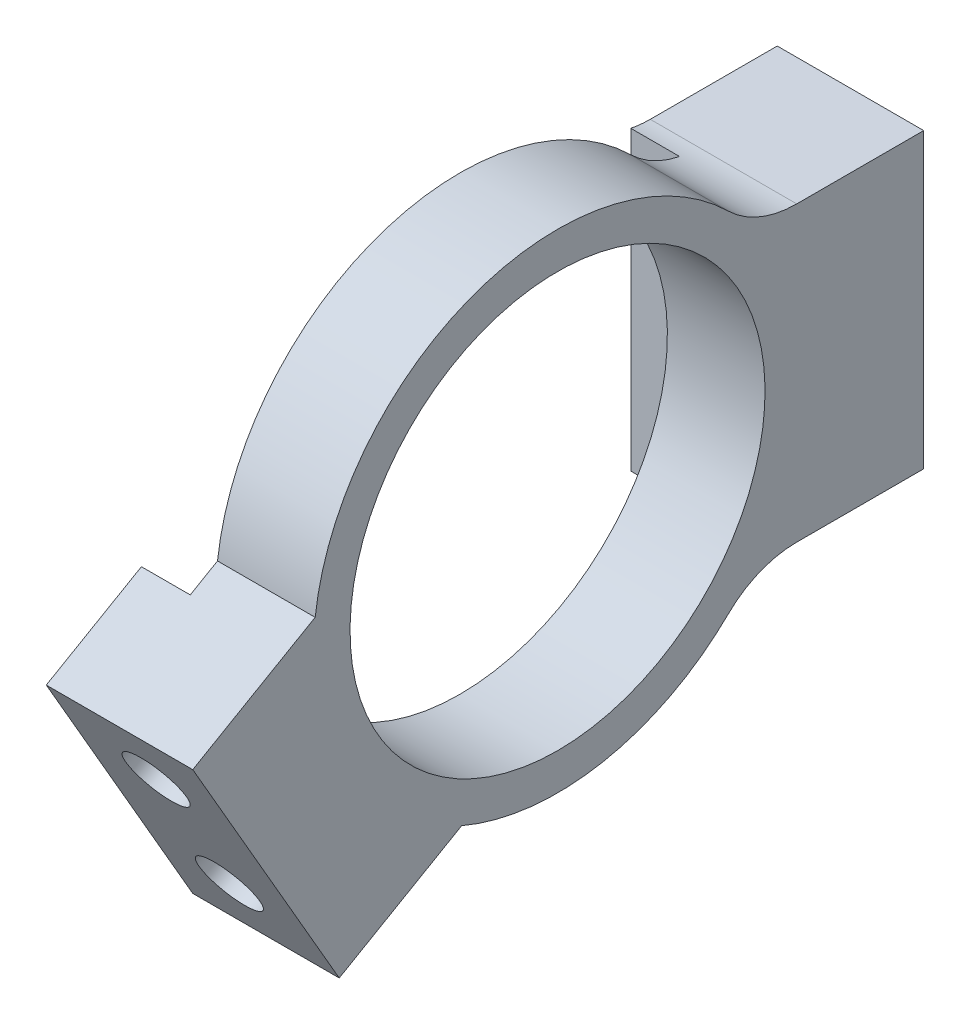
from build123d import *

# Parameters (mm, degrees)
SKETCH1_W       = 6
SKETCH1_H       = 12
EXTRUDE1_DEPTH  = 6
SKETCH3_W       = 4
SKETCH3_H       = 8.6
EXTRUDE2_DEPTH  = 1
SKETCH2_R       = 1.25
EXTRUDE3_DEPTH  = 5.5
EXTRUDE4_DEPTH  = 4
SKETCH6_R       = 8.5
EXTRUDE5_DEPTH  = 4
FILLET1_R       = 4
EXTRUDE9_START  = -4
EXTRUDE9_DEPTH  = 4
EXTRUDE10_DEPTH = 2
SKETCH14_R      = 1.25
EXTRUDE11_DEPTH = 4


with BuildPart() as part:
    # Sketch1 → Extrude1 (new body)
    with BuildSketch(Plane.XY):
        with Locations((-1, 0)):
            Rectangle(SKETCH1_W, SKETCH1_H)
    extrude(amount=EXTRUDE1_DEPTH)

    # Sketch3 → Extrude2 (add)
    with BuildSketch(Plane.XY.offset(6)):
        Rectangle(SKETCH3_W, SKETCH3_H)
    extrude(amount=EXTRUDE2_DEPTH)

    # Sketch2 → Extrude3 (cut)
    with BuildSketch(Plane(origin=(0, 0, 0), x_dir=(-1, 0, 0), z_dir=(0, 0, -1))):
        with Locations((1, 3)):
            Circle(SKETCH2_R)
        with Locations((1, -3)):
            Circle(SKETCH2_R)
    extrude(amount=-EXTRUDE3_DEPTH, mode=Mode.SUBTRACT)

    # Sketch4 → Extrude4 (add)
    with BuildSketch(Plane(origin=(2, 0, 0), x_dir=(0, 0, -1), z_dir=(1, 0, 0))):
        with BuildLine():
            Line((-7, 6), (-6, 6))
            Line((-6, 6), (-6, -6))
            Line((-6, -6), (-7, -6))
            ThreePointArc((-7, -6), (-25, 0), (-7, 6))
        make_face()
    extrude(amount=-EXTRUDE4_DEPTH)

    # Sketch6 → Extrude5 (cut)
    with BuildSketch(Plane.ZY.offset(2)):
        with Locations(Location((15, 0, 0), (0, 0, 270))):
            Circle(SKETCH6_R)
    extrude(amount=-EXTRUDE5_DEPTH, mode=Mode.SUBTRACT)

    # Fillet1
    # the kernel refuses this fillet: 4 mm, written as the material it adds along each edge
    with BuildSketch(Plane(origin=(2, 6, 7), x_dir=(0, 0, -1), z_dir=(-1, 0, 0))) as fillet1_piece_1_section:
        with BuildLine():
            CenterArc((1.797958971, -4), FILLET1_R, 90, 44.415308597)
            ThreePointArc((-1.001457878, -1.142857143), (-0.478989625, -0.590478203), (0, 0))
            Line((0, 0), (1.797958971, 0))
        make_face()
    fillet1_piece_1 = extrude(amount=4, mode=Mode.PRIVATE)
    fillet1_piece_1 = split(fillet1_piece_1, bisect_by=Plane(origin=(0, 5.976030652, 6), z_dir=(0, 0, -1)), keep=Keep.TOP, mode=Mode.PRIVATE)
    add(fillet1_piece_1)
    with BuildSketch(Plane(origin=(2, 6, 7), x_dir=(0, 0, -1), z_dir=(-1, 0, 0))) as fillet1_piece_2_section:
        with BuildLine():
            CenterArc((1.797958971, -4), FILLET1_R, 90, 44.415308597)
            ThreePointArc((-1.001457878, -1.142857143), (-0.478989625, -0.590478203), (0, 0))
            Line((0, 0), (1.797958971, 0))
        make_face()
    fillet1_piece_2 = extrude(amount=4, mode=Mode.PRIVATE)
    fillet1_piece_2 = split(fillet1_piece_2, bisect_by=Plane(origin=(0, 6.277319808, 6), z_dir=(0, 0, 1)), keep=Keep.TOP, mode=Mode.PRIVATE)
    add(fillet1_piece_2)
    with BuildSketch(Plane(origin=(2, 6, 7), x_dir=(0, 0, -1), z_dir=(-1, 0, 0))) as fillet1_piece_3_section:
        with BuildLine():
            CenterArc((1.797958971, -4), FILLET1_R, 90, 44.415308597)
            ThreePointArc((-1.001457878, -1.142857143), (-0.478989625, -0.590478203), (0, 0))
            Line((0, 0), (1.797958971, 0))
        make_face()
    fillet1_piece_3 = extrude(amount=8.494897428, mode=Mode.PRIVATE)
    fillet1_piece_3 = split(fillet1_piece_3, bisect_by=Plane(origin=(-4, 5.976030652, 5.651028554), z_dir=(1, 0, 0)), keep=Keep.TOP, mode=Mode.PRIVATE)
    fillet1_piece_3 = split(fillet1_piece_3, bisect_by=Plane(origin=(-3, 5.976030652, 6), z_dir=(0, 0, -1)), keep=Keep.TOP, mode=Mode.PRIVATE)
    fillet1_piece_3 = split(fillet1_piece_3, bisect_by=Plane(origin=(-2, 5.976030652, 5.651028554), z_dir=(-1, 0, 0)), keep=Keep.TOP, mode=Mode.PRIVATE)
    add(fillet1_piece_3)
    with BuildSketch(Plane(origin=(2, -6, 7), x_dir=(0, -0.7521010374968901, 0.6590478202650409), z_dir=(-1, 0, 0))) as fillet1_piece_4_section:
        with BuildLine():
            CenterArc((1.823463209, -3.988438089), FILLET1_R, 94.357396878, 44.415308597)
            Line((-1.184940941, -1.352246808), (0, 0))
            ThreePointArc((0, 0), (0.759776337, -0.028904778), (1.519552674, 0))
        make_face()
    fillet1_piece_4 = extrude(amount=4, mode=Mode.PRIVATE)
    fillet1_piece_4 = split(fillet1_piece_4, bisect_by=Plane(origin=(0, -6.277319808, 6), z_dir=(0, 0, 1)), keep=Keep.TOP, mode=Mode.PRIVATE)
    add(fillet1_piece_4)
    with BuildSketch(Plane(origin=(2, -6, 7), x_dir=(0, -0.7521010374968901, 0.6590478202650409), z_dir=(-1, 0, 0))) as fillet1_piece_5_section:
        with BuildLine():
            CenterArc((1.823463209, -3.988438089), FILLET1_R, 94.357396878, 44.415308597)
            Line((-1.184940941, -1.352246808), (0, 0))
            ThreePointArc((0, 0), (0.759776337, -0.028904778), (1.519552674, 0))
        make_face()
    fillet1_piece_5 = extrude(amount=4, mode=Mode.PRIVATE)
    fillet1_piece_5 = split(fillet1_piece_5, bisect_by=Plane(origin=(0, -5.976030652, 6), z_dir=(0, 0, -1)), keep=Keep.TOP, mode=Mode.PRIVATE)
    add(fillet1_piece_5)
    with BuildSketch(Plane(origin=(2, -6, 7), x_dir=(0, -0.7521010374968901, 0.6590478202650409), z_dir=(-1, 0, 0))) as fillet1_piece_6_section:
        with BuildLine():
            CenterArc((1.823463209, -3.988438089), FILLET1_R, 94.357396878, 44.415308597)
            Line((-1.184940941, -1.352246808), (0, 0))
            ThreePointArc((0, 0), (0.759776337, -0.028904778), (1.519552674, 0))
        make_face()
    fillet1_piece_6 = extrude(amount=8.494897428, mode=Mode.PRIVATE)
    fillet1_piece_6 = split(fillet1_piece_6, bisect_by=Plane(origin=(-4, -5.976030652, 5.651028554), z_dir=(1, 0, 0)), keep=Keep.TOP, mode=Mode.PRIVATE)
    fillet1_piece_6 = split(fillet1_piece_6, bisect_by=Plane(origin=(-3, -5.976030652, 6), z_dir=(0, 0, -1)), keep=Keep.TOP, mode=Mode.PRIVATE)
    fillet1_piece_6 = split(fillet1_piece_6, bisect_by=Plane(origin=(-2, -5.976030652, 5.651028554), z_dir=(-1, 0, 0)), keep=Keep.TOP, mode=Mode.PRIVATE)
    add(fillet1_piece_6)

    # Sketch12 → Extrude9 (add)
    with BuildSketch(Plane.ZY.offset(2).offset(EXTRUDE9_START)):
        with BuildLine():
            Line((18.92820323, -9.196152423), (23.942490318, -12.091152423))
            Line((23.942490318, -12.091152423), (29.942490318, -1.698847577))
            Line((29.942490318, -1.698847577), (24.92820323, 1.196152423))
            ThreePointArc((24.92820323, 1.196152423), (23.660254038, -5), (18.92820323, -9.196152423))
        make_face()
    extrude(amount=EXTRUDE9_DEPTH)

    # Sketch13 → Extrude10 (add)
    with BuildSketch(Plane.ZY.offset(2)):
        Polygon((29.942490318, -1.698847577), (26.045376001, 0.551152423), (20.045376001, -9.841152423), (23.942490318, -12.091152423), align=None)
    extrude(amount=EXTRUDE10_DEPTH)

    # Sketch14 → Extrude11 (cut)
    with BuildSketch(Plane(origin=(0, -13.390190528, 23.192490318), x_dir=(1, 0, 0), z_dir=(0, -0.5000000000000007, 0.8660254037844383))):
        with Locations(Location((-1, 4.5, 0), (0, 0, 270))):
            Circle(SKETCH14_R)
        with Locations(Location((-1, 10.5, 0), (0, 0, 270))):
            Circle(SKETCH14_R)
    extrude(amount=-EXTRUDE11_DEPTH, mode=Mode.SUBTRACT)


solid = part.part
